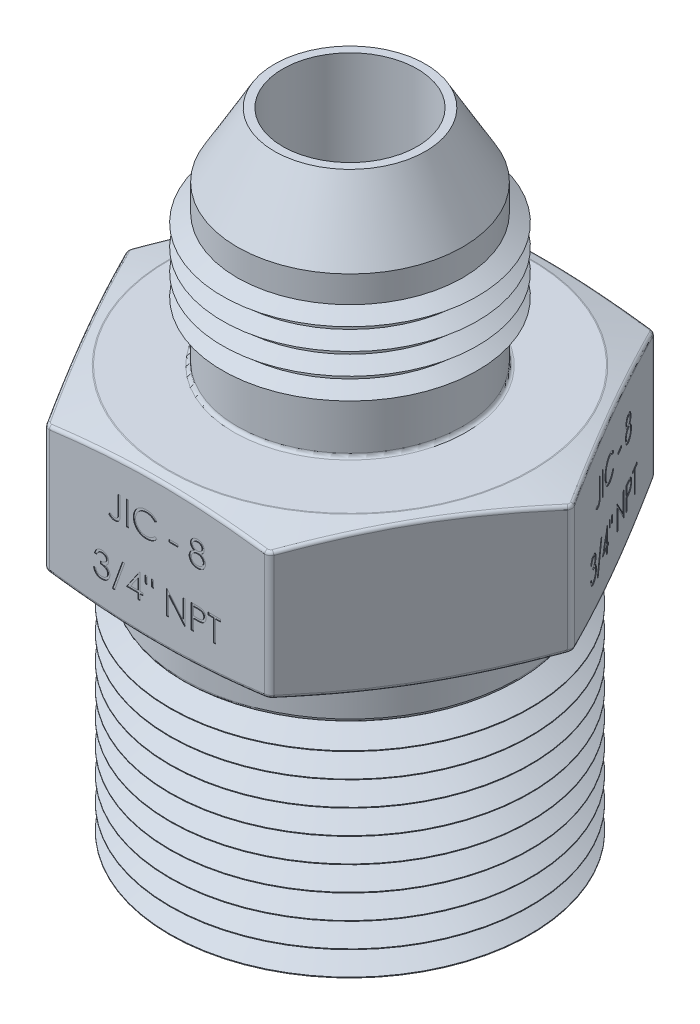
from build123d import *

# Parameters (mm, degrees)
BOSS_EXTRUDE1_DEPTH        = 5.461
SKETCH2_OUTSIDE_W          = 105.612
SKETCH2_OUTSIDE_H          = 101.192
SKETCH2_OUTSIDE_R          = 13.462
CUT_EXTRUDE1_DEPTH         = 8.255
CUT_EXTRUDE1_DRAFT         = -75
SKETCH3_OUTSIDE_W          = 105.612
SKETCH3_OUTSIDE_H          = 101.192
SKETCH3_OUTSIDE_R          = 13.462
CUT_EXTRUDE2_DEPTH         = 8.255
CUT_EXTRUDE2_DRAFT         = -75
FILLET1_R                  = 0.508
FILLET2_R                  = 0.254
SKETCH8_R                  = 8.3439
BOSS_EXTRUDE6_DEPTH        = 16.51
FILLET3_R                  = 0.254
SKETCH_PART_SPECS_INFO_W   = 0.159564103
SKETCH_PART_SPECS_INFO_H   = 1.778
SKETCH_PART_SPECS_INFO_W_2 = 0.683846154
SKETCH_PART_SPECS_INFO_H_2 = 0.182358975
CUT_PART_SPECS_DEPTH       = 0.0508
CHAMFER1_SIZE              = 4.7625
CHAMFER1_SIZE2             = 2.749630657
LPATTERN2_COUNT            = 4
LPATTERN2_PITCH            = 1.5875
SKETCH4_R                  = 12.3825
BOSS_EXTRUDE7_DEPTH        = 3.175
SKETCH13_R                 = 13.335
BOSS_EXTRUDE8_DEPTH        = 16.637
LPATTERN3_COUNT            = 10
LPATTERN3_PITCH            = 1.814285714
SKETCH15_R                 = 4.9784
CUT_EXTRUDE3_DEPTH         = 47.244
FILLET4_R                  = 0.254
CIRPATTERN1_COUNT          = 3
CHAMFER2_SIZE              = 0.508


with BuildPart() as part:
    # Sketch1 → Boss-Extrude1 (new, symmetric)
    with BuildSketch(Plane(origin=(0, 0, 0), x_dir=(1, 0, 0), z_dir=(0, 1, 0))):
        Polygon((16.497783942, 0), (8.248891971, 14.2875), (-8.248891971, 14.2875), (-16.497783942, 0), (-8.248891971, -14.2875), (8.248891971, -14.2875), align=None)
    extrude(amount=BOSS_EXTRUDE1_DEPTH, both=True)


with BuildPart() as cut_extrude1_tool:
    # Sketch2 outside → Cut-Extrude1 (with draft: the straight prism first)
    with BuildSketch(Plane(origin=(0, 5.461, 0), x_dir=(1, 0, 0), z_dir=(0, 1, 0))):
        Rectangle(SKETCH2_OUTSIDE_W, SKETCH2_OUTSIDE_H)
        Circle(SKETCH2_OUTSIDE_R, mode=Mode.SUBTRACT)
    extrude(amount=-CUT_EXTRUDE1_DEPTH)
    # Cut-Extrude1: the draft: its side faces are tilted about the plane it starts from
    cut_extrude1_sides = [cut_extrude1_tool.faces().sort_by_distance(p)[0] for p in [
        (0, 1.3335, 50.596),
        (52.806, 1.3335, 0),
        (0, 1.3335, -50.596),
        (-52.806, 1.3335, 0),
        (-13.462, 1.3335, 0),
    ]]
    draft(cut_extrude1_sides, Plane(origin=(0, 5.461, 0), x_dir=(1, 0, 0), z_dir=(0, 1, 0)), CUT_EXTRUDE1_DRAFT)


with BuildPart() as part_1:
    add(part.part)

    # Cut-Extrude1: cut by cut_extrude1_tool
    add(cut_extrude1_tool.part, mode=Mode.SUBTRACT)


with BuildPart() as cut_extrude2_tool:
    # Sketch3 outside → Cut-Extrude2 (with draft: the straight prism first)
    with BuildSketch(Plane.XZ.offset(5.461)):
        Rectangle(SKETCH3_OUTSIDE_W, SKETCH3_OUTSIDE_H)
        Circle(SKETCH3_OUTSIDE_R, mode=Mode.SUBTRACT)
    extrude(amount=-CUT_EXTRUDE2_DEPTH)
    # Cut-Extrude2: the draft: its side faces are tilted about the plane it starts from
    cut_extrude2_sides = [cut_extrude2_tool.faces().sort_by_distance(p)[0] for p in [
        (0, -1.3335, -50.596),
        (52.806, -1.3335, 0),
        (0, -1.3335, 50.596),
        (-52.806, -1.3335, 0),
        (-13.462, -1.3335, 0),
    ]]
    draft(cut_extrude2_sides, Plane.XZ.offset(5.461), CUT_EXTRUDE2_DRAFT)


with BuildPart() as part_2:
    add(part_1.part)

    # Cut-Extrude2: cut by cut_extrude2_tool
    add(cut_extrude2_tool.part, mode=Mode.SUBTRACT)

    # Fillet1
    # the kernel refuses this fillet: 0.508 mm, written as the material it takes off along each edge
    with BuildSketch(Plane(origin=(8.248891971, 5.380798986, 14.2875), x_dir=(0.5000000000000017, 0, -0.8660254037844377), z_dir=(0, -1, 0)), Plane(origin=(-8.248891971, 5.380798986, 14.2875), x_dir=(1, 0, 0), z_dir=(0, -1, 0)), Plane(origin=(-8.248891971, -5.380798986, -14.2875), x_dir=(1, 0, 0), z_dir=(0, 1, 0)), Plane(origin=(8.248891971, -5.380798986, -14.2875), x_dir=(0.4999999999999997, 0, 0.8660254037844387), z_dir=(0, 1, 0)), Plane(origin=(16.497783942, 5.380798986, 0), x_dir=(-0.5000000000000067, 0, -0.8660254037844349), z_dir=(0, -1, 0))) as fillet1_piece_1:
        with BuildLine():
            CenterArc((FILLET1_R * 0.57735026919, -FILLET1_R), FILLET1_R, 90, 60)
            Line((-FILLET1_R * 0.288675134595, -FILLET1_R * 0.5), (0, 0))
            Line((0, 0), (FILLET1_R * 0.57735026919, 0))
        make_face()
    extrude(amount=10.761597972, mode=Mode.SUBTRACT)
    with BuildSketch(Plane(origin=(-16.497783942, -5.380798986, 0), x_dir=(0.5000000000000077, 0, 0.8660254037844343), z_dir=(0, 1, 0))) as fillet1_piece_2:
        with BuildLine():
            CenterArc((FILLET1_R * 0.57735026919, FILLET1_R), FILLET1_R, 210, 60)
            Line((-FILLET1_R * 0.288675134595, FILLET1_R * 0.5), (0, 0))
            Line((0, 0), (FILLET1_R * 0.57735026919, 0))
        make_face()
    extrude(amount=10.761597972, mode=Mode.SUBTRACT)

    # Fillet2
    fillet2_edges = [part_2.edges().sort_by_distance(p)[0] for p in [
        (-13.462, 5.461, 0),
        (12.373337957, -5.239807942, 7.14375),
        (12.373337957, 5.239807942, 7.14375),
        (0, -5.239807942, 14.2875),
        (-12.373337957, -5.239807942, 7.14375),
        (-12.373337957, -5.239807942, -7.14375),
        (0, -5.239807942, -14.2875),
        (12.373337957, -5.239807942, -7.14375),
        (16.401812039, -4.673137939, 0.131757237),
        (8.209598034, -4.668621702, -14.219440905),
        (-8.209598034, -4.668621702, -14.219440905),
        (-16.419196069, -4.668621702, 0),
        (-8.209598034, -4.668621702, 14.219440905),
        (8.209598034, -4.668621702, 14.219440905),
        (0, 5.239807942, 14.2875),
        (12.373337957, 5.239807942, -7.14375),
        (0, 5.239807942, -14.2875),
        (-12.373337957, 5.239807942, -7.14375),
        (-12.373337957, 5.239807942, 7.14375),
        (16.401812039, 4.673137939, -0.131757237),
        (8.209598034, 4.668621702, -14.219440905),
        (-8.209598034, 4.668621702, -14.219440905),
        (-16.419196069, 4.668621702, 0),
        (-8.209598034, 4.668621702, 14.219440905),
        (8.209598034, 4.668621702, 14.219440905),
    ]]
    fillet(fillet2_edges, radius=FILLET2_R)

    # Sketch8 → Boss-Extrude6 (add)
    with BuildSketch(Plane(origin=(0, 5.461, 0), x_dir=(1, 0, 0), z_dir=(0, 1, 0))):
        with Locations(Location((0, 0, 0), (0, 0, 270))):
            Circle(SKETCH8_R)
    extrude(amount=BOSS_EXTRUDE6_DEPTH)

    # Fillet3
    fillet3_edges = [part_2.edges().sort_by_distance(p)[0] for p in [
        (0, 5.461, -8.3439),
    ]]
    fillet(fillet3_edges, radius=FILLET3_R)

    # Sketch Part Specs Info → Cut Part Specs (cut)
    # profile 1 of 13: a face of its own
    with BuildSketch(Plane.XY.offset(14.2875)):
        with BuildLine():
            Line((-2.883551282, 2.8981131), (-2.723987179, 2.8981131))
            Line((-2.723987179, 2.8981131), (-2.723987179, 1.697464462))
            add(Edge.make_bspline(
                [(-2.723987179, 1.697464462), (-2.72414665, 1.675262235), (-2.724452853, 1.63263125), (-2.726136574, 1.571227311), (-2.729252381, 1.515159003), (-2.733791367, 1.464298832), (-2.739846845, 1.418806133), (-2.746776488, 1.378329396), (-2.755164989, 1.343206437), (-2.767797154, 1.303767676), (-2.78851032, 1.260514623), (-2.819684775, 1.213801407), (-2.858411036, 1.172941234), (-2.903267961, 1.13745605), (-2.954647601, 1.109182177), (-3.011491896, 1.088884946), (-3.073450923, 1.076504551), (-3.116427323, 1.075197007), (-3.13856891, 1.074523356)],
                knots=[0, 0, 0, 0, 1.237770943, 2.376671248, 3.424123796, 4.367912054, 5.222547132, 5.982086412, 6.656319012, 7.234008312, 8.288027371, 9.317870876, 10.352700517, 11.413286737, 12.494591526, 13.606319346, 14.766767577, 16, 16, 16, 16], degree=3))
            add(Edge.make_bspline(
                [(-3.13856891, 1.074523356), (-3.155819756, 1.075072305), (-3.190529601, 1.076176828), (-3.242188481, 1.085179458), (-3.293700685, 1.099056008), (-3.345339621, 1.119377327), (-3.398125515, 1.147015371), (-3.452773283, 1.183177258), (-3.509985865, 1.227795673), (-3.547670974, 1.261850848), (-3.567397436, 1.279677202)],
                knots=[0, 0, 0, 0, 0.848567217, 1.707373443, 2.573483905, 3.470863513, 4.432650262, 5.500696352, 6.691726801, 8, 8, 8, 8], degree=3))
            Line((-3.567397436, 1.279677202), (-3.47336859, 1.416446433))
            add(Edge.make_bspline(
                [(-3.47336859, 1.416446433), (-3.451675629, 1.401487156), (-3.41071649, 1.37324209), (-3.350516234, 1.336906577), (-3.29717768, 1.305753393), (-3.262286743, 1.289877235), (-3.246132212, 1.282526561)],
                knots=[0, 0, 0, 0, 1.196737151, 2.259595785, 3.194191475, 4, 4, 4, 4], degree=3))
            add(Edge.make_bspline(
                [(-3.246132212, 1.282526561), (-3.236335781, 1.278686357), (-3.2171228, 1.271154861), (-3.18774766, 1.262749545), (-3.158540181, 1.258156), (-3.139176392, 1.257301883), (-3.129664663, 1.25688233)],
                knots=[0, 0, 0, 0, 1.051806502, 2.062826769, 3.048436908, 4, 4, 4, 4], degree=3))
            add(Edge.make_bspline(
                [(-3.129664663, 1.25688233), (-3.117379807, 1.25740188), (-3.093097175, 1.258428837), (-3.057809466, 1.267496269), (-3.024048786, 1.281336426), (-2.9930254, 1.301601203), (-2.964432424, 1.325696365), (-2.940839468, 1.354833217), (-2.921171108, 1.387124737), (-2.909334864, 1.417691836), (-2.90179372, 1.445569164), (-2.897007533, 1.471189197), (-2.892822294, 1.501141628), (-2.889174065, 1.53546221), (-2.887038194, 1.574219654), (-2.88464182, 1.617300159), (-2.883775547, 1.664812338), (-2.883628318, 1.697939502), (-2.883551282, 1.715272955)],
                knots=[0, 0, 0, 0, 0.997221856, 1.971139923, 2.944579524, 3.951425367, 4.971190333, 5.972282193, 6.985401279, 8.033996657, 8.624075553, 9.332086008, 10.151144245, 11.082816738, 12.137127781, 13.306538797, 14.590673636, 16, 16, 16, 16], degree=3))
            Line((-2.883551282, 1.715272955), (-2.883551282, 2.8981131))
        make_face()
    # profile 2 of 13: a face of its own
    with BuildSketch(Plane.XY.offset(14.2875)):
        with Locations((-2.188307693, 2.0091131)):
            Rectangle(SKETCH_PART_SPECS_INFO_W, SKETCH_PART_SPECS_INFO_H)
    # profile 3 of 13: a face of its own
    with BuildSketch(Plane.XY.offset(14.2875)):
        with BuildLine():
            Line((-0.011397436, 2.571861497), (-0.151016026, 2.465010536))
            add(Edge.make_bspline(
                [(-0.151016026, 2.465010536), (-0.160975817, 2.476880448), (-0.18076112, 2.500460241), (-0.212591995, 2.53357145), (-0.245765229, 2.564592603), (-0.280268143, 2.593671478), (-0.316721776, 2.619791195), (-0.354243061, 2.644312915), (-0.393459668, 2.666292926), (-0.44768955, 2.692944123), (-0.518630656, 2.720755169), (-0.607934435, 2.744074011), (-0.701158073, 2.758918368), (-0.764758453, 2.760526108), (-0.797108173, 2.761343869)],
                knots=[0, 0, 0, 0, 0.757959112, 1.505699292, 2.245454638, 2.979532153, 3.711538275, 4.438200793, 5.171680507, 5.909471876, 7.393775596, 8.890124382, 10.418191784, 12, 12, 12, 12], degree=3))
            add(Edge.make_bspline(
                [(-0.797108173, 2.761343869), (-0.814930489, 2.761138656), (-0.850409713, 2.760730135), (-0.903063138, 2.755340699), (-0.954733368, 2.747765804), (-1.005386793, 2.73652614), (-1.054958936, 2.72231605), (-1.103773876, 2.705335939), (-1.151124861, 2.684327681), (-1.197666926, 2.661107885), (-1.242258765, 2.634881143), (-1.284450729, 2.60627396), (-1.324088937, 2.575606459), (-1.361204744, 2.542763697), (-1.395836093, 2.507893581), (-1.427732047, 2.470624495), (-1.456782236, 2.431075591), (-1.483562485, 2.38976838), (-1.507546553, 2.346823182), (-1.527627732, 2.302081046), (-1.545410334, 2.256308162), (-1.559481549, 2.208987372), (-1.570619204, 2.160451647), (-1.578304057, 2.110570727), (-1.5836322, 2.059448818), (-1.58403869, 2.024798487), (-1.58424359, 2.00733225)],
                knots=[0, 0, 0, 0, 1.054917814, 2.100044995, 3.131103042, 4.146048494, 5.169673617, 6.183595914, 7.203665975, 8.234915748, 9.262203917, 10.264457458, 11.251630812, 12.227803204, 13.197192746, 14.159520551, 15.12972552, 16.100847026, 17.073214652, 18.039054194, 19.002613845, 19.979014051, 20.95965708, 21.949030935, 22.966165397, 24, 24, 24, 24], degree=3))
            add(Edge.make_bspline(
                [(-1.58424359, 2.00733225), (-1.583602586, 1.98105274), (-1.582344059, 1.929456407), (-1.571143506, 1.853880936), (-1.554122919, 1.781480434), (-1.528613406, 1.712707474), (-1.497158528, 1.646714028), (-1.457412298, 1.584616691), (-1.411379097, 1.525477076), (-1.358407692, 1.470692859), (-1.300289537, 1.420647886), (-1.237933598, 1.376578591), (-1.17149518, 1.33984263), (-1.101707852, 1.30927325), (-1.028034586, 1.285774832), (-0.950607866, 1.269232257), (-0.869596093, 1.25844123), (-0.814239637, 1.257408116), (-0.786066907, 1.25688233)],
                knots=[0, 0, 0, 0, 1.029171465, 2.020641659, 2.987623507, 3.938342917, 4.889210282, 5.84687017, 6.821220943, 7.821438502, 8.827599549, 9.822697543, 10.807740252, 11.797342354, 12.80366471, 13.83203677, 14.896651826, 16, 16, 16, 16], degree=3))
            add(Edge.make_bspline(
                [(-0.786066907, 1.25688233), (-0.755026741, 1.25774023), (-0.693932269, 1.259428783), (-0.604337312, 1.273733682), (-0.518568743, 1.296927904), (-0.436621949, 1.329388048), (-0.358727948, 1.371585215), (-0.284764845, 1.422739736), (-0.214670207, 1.48333821), (-0.172520796, 1.529608439), (-0.151016026, 1.553215664)],
                knots=[0, 0, 0, 0, 1.028121516, 2.023589091, 2.998037872, 3.967518031, 4.937445131, 5.927275754, 6.942489185, 8, 8, 8, 8], degree=3))
            Line((-0.151016026, 1.553215664), (-0.011397436, 1.447433212))
            add(Edge.make_bspline(
                [(-0.011397436, 1.447433212), (-0.022633436, 1.432935678), (-0.045051616, 1.404010053), (-0.081352288, 1.363232025), (-0.119593155, 1.324875975), (-0.160058256, 1.289251143), (-0.202282094, 1.255644675), (-0.247022829, 1.225011344), (-0.293692297, 1.196923575), (-0.342132373, 1.171205098), (-0.392291588, 1.148387136), (-0.444109841, 1.128852622), (-0.497363773, 1.112025178), (-0.552055819, 1.098181194), (-0.608299424, 1.087375484), (-0.665891625, 1.080151889), (-0.724956721, 1.075202996), (-0.764804963, 1.074751935), (-0.784998397, 1.074523356)],
                knots=[0, 0, 0, 0, 0.986787822, 1.968848986, 2.935600012, 3.899624008, 4.868462664, 5.837806735, 6.815139263, 7.798259679, 8.787526145, 9.778297419, 10.776456485, 11.791383307, 12.812564526, 13.85620153, 14.913611965, 16, 16, 16, 16], degree=3))
            add(Edge.make_bspline(
                [(-0.784998397, 1.074523356), (-0.80412138, 1.074656448), (-0.841934711, 1.074919622), (-0.897763277, 1.079182843), (-0.952113984, 1.084999309), (-1.004831494, 1.093757296), (-1.056203489, 1.10409222), (-1.105764266, 1.117946019), (-1.154001513, 1.133464995), (-1.20072143, 1.151704729), (-1.245963757, 1.172286949), (-1.289582574, 1.195549061), (-1.331557817, 1.221295449), (-1.372302171, 1.248958594), (-1.411213743, 1.279427063), (-1.448629734, 1.312277713), (-1.484759952, 1.347399823), (-1.507113316, 1.372726088), (-1.518352163, 1.385459654)],
                knots=[0, 0, 0, 0, 1.114604814, 2.203992996, 3.262667896, 4.300477797, 5.318619304, 6.316056647, 7.298880507, 8.271930387, 9.238335007, 10.195173496, 11.151986948, 12.108099108, 13.064862484, 14.031167946, 15.010108607, 16, 16, 16, 16], degree=3))
            add(Edge.make_bspline(
                [(-1.518352163, 1.385459654), (-1.53635347, 1.407578578), (-1.572138757, 1.451549387), (-1.617922604, 1.522814665), (-1.657113562, 1.597220516), (-1.68880053, 1.675157839), (-1.713571998, 1.756451752), (-1.730732845, 1.841143233), (-1.74188426, 1.929153188), (-1.743159487, 1.989014277), (-1.743807692, 2.019442026)],
                knots=[0, 0, 0, 0, 0.994628077, 1.977248131, 2.950237994, 3.925870899, 4.908910175, 5.911660606, 6.938484602, 8, 8, 8, 8], degree=3))
            add(Edge.make_bspline(
                [(-1.743807692, 2.019442026), (-1.743017654, 2.051423396), (-1.741463303, 2.114344746), (-1.728257439, 2.206685914), (-1.70701349, 2.295154825), (-1.676839871, 2.379586327), (-1.638584752, 2.460424509), (-1.591327233, 2.537051842), (-1.535616324, 2.609958376), (-1.47188896, 2.678037869), (-1.402004754, 2.740287861), (-1.327166796, 2.795053412), (-1.247521567, 2.84062991), (-1.163946498, 2.878727961), (-1.075815772, 2.908011348), (-0.983317421, 2.928510767), (-0.886625252, 2.941270262), (-0.82065514, 2.942883267), (-0.787135417, 2.943702843)],
                knots=[0, 0, 0, 0, 1.032925535, 2.032216505, 3.007276963, 3.968222605, 4.92396291, 5.891752235, 6.871517503, 7.883894988, 8.900124299, 9.891468569, 10.874487609, 11.85992873, 12.854644235, 13.869047385, 14.917252991, 16, 16, 16, 16], degree=3))
            add(Edge.make_bspline(
                [(-0.787135417, 2.943702843), (-0.766706465, 2.943457917), (-0.726269412, 2.94297311), (-0.666451065, 2.93824559), (-0.608212763, 2.930364678), (-0.551514384, 2.919637715), (-0.496080095, 2.906324395), (-0.442333573, 2.888981124), (-0.38995944, 2.869150566), (-0.33928801, 2.846311665), (-0.290562403, 2.820674561), (-0.243797793, 2.792523424), (-0.199365645, 2.761893155), (-0.15695331, 2.729044261), (-0.117270274, 2.693281793), (-0.079189843, 2.655589415), (-0.044005216, 2.614881432), (-0.022286593, 2.586227725), (-0.011397436, 2.571861497)],
                knots=[0, 0, 0, 0, 1.096760587, 2.17092713, 3.219439832, 4.250915756, 5.268269357, 6.278326846, 7.281116186, 8.274029601, 9.260640565, 10.235837813, 11.203064059, 12.156899882, 13.114053108, 14.069676657, 15.032185724, 16, 16, 16, 16], degree=3))
        make_face()
    # profile 4 of 13: a face of its own
    with BuildSketch(Plane.XY.offset(14.2875)):
        with Locations((1.219525641, 1.803959253)):
            Rectangle(SKETCH_PART_SPECS_INFO_W_2, SKETCH_PART_SPECS_INFO_H_2)
    # profile 5 of 13: a face of its own
    with BuildSketch(Plane.XY.offset(14.2875)):
        with BuildLine():
            add(Edge.make_bspline(
                [(3.246488381, 2.110621513), (3.261041843, 2.103033031), (3.289425955, 2.088232958), (3.329851176, 2.064402258), (3.366795477, 2.039286247), (3.401283882, 2.014071231), (3.432710465, 1.987791552), (3.460723826, 1.960342709), (3.486015937, 1.932409848), (3.508076743, 1.903519969), (3.527480737, 1.873749824), (3.544250901, 1.843021273), (3.55858524, 1.811401659), (3.569945613, 1.77854583), (3.579303883, 1.744936417), (3.585743091, 1.710139442), (3.589206085, 1.674384197), (3.589860802, 1.6502195), (3.590192308, 1.637984093)],
                knots=[0, 0, 0, 0, 1.272397273, 2.481599622, 3.635517121, 4.734568067, 5.792894095, 6.808321871, 7.773003508, 8.711915296, 9.623354172, 10.525449501, 11.423591555, 12.311487226, 13.218079475, 14.126165749, 15.051214107, 16, 16, 16, 16], degree=3))
            add(Edge.make_bspline(
                [(3.590192308, 1.637984093), (3.589800426, 1.620865645), (3.589024745, 1.586981813), (3.582268353, 1.536971188), (3.57215256, 1.488400403), (3.557380168, 1.441280106), (3.538221766, 1.395870304), (3.514611533, 1.352132127), (3.487885041, 1.309348718), (3.466420903, 1.283024462), (3.455560096, 1.269704446)],
                knots=[0, 0, 0, 0, 1.025265484, 2.029385089, 3.018602448, 3.995076438, 4.983346944, 5.966715145, 6.97116228, 8, 8, 8, 8], degree=3))
            add(Edge.make_bspline(
                [(3.455560096, 1.269704446), (3.441419167, 1.254162808), (3.413312053, 1.223271586), (3.365162325, 1.183164575), (3.312319208, 1.149459083), (3.254987176, 1.12199056), (3.19331948, 1.100610944), (3.127329262, 1.085247745), (3.056887872, 1.076447951), (3.008472693, 1.075175924), (2.983635016, 1.074523356)],
                knots=[0, 0, 0, 0, 0.954267603, 1.896743057, 2.838368354, 3.796610408, 4.779680527, 5.799409237, 6.871065594, 8, 8, 8, 8], degree=3))
            add(Edge.make_bspline(
                [(2.983635016, 1.074523356), (2.959752215, 1.075108815), (2.913278709, 1.076248058), (2.845634507, 1.083966829), (2.782579988, 1.097493786), (2.723748524, 1.116007647), (2.669494787, 1.140092043), (2.619973372, 1.170068315), (2.574469794, 1.204729887), (2.534364986, 1.245072239), (2.498760056, 1.288281638), (2.467483485, 1.332859456), (2.441487053, 1.378809762), (2.419476889, 1.425447396), (2.402627533, 1.473426043), (2.39095765, 1.522498849), (2.383546279, 1.572580102), (2.382560182, 1.606378182), (2.382064103, 1.623381128)],
                knots=[0, 0, 0, 0, 1.256902934, 2.445805442, 3.576955095, 4.645999104, 5.686449165, 6.692658513, 7.68621702, 8.689161843, 9.678783111, 10.630372946, 11.551080876, 12.453998257, 13.34127905, 14.221779781, 15.105423033, 16, 16, 16, 16], degree=3))
            add(Edge.make_bspline(
                [(2.382064103, 1.623381128), (2.382357666, 1.635857198), (2.382937851, 1.660514315), (2.386953514, 1.696942654), (2.393409413, 1.73239909), (2.402177217, 1.767014588), (2.414059858, 1.800537138), (2.428406862, 1.833125579), (2.445136294, 1.864816701), (2.464481525, 1.895783813), (2.486986954, 1.925593005), (2.512470088, 1.95475017), (2.541440245, 1.982802879), (2.573575136, 2.010093871), (2.608507522, 2.037107265), (2.647144747, 2.062383176), (2.688462555, 2.087711022), (2.717827701, 2.102853651), (2.732891426, 2.110621513)],
                knots=[0, 0, 0, 0, 0.941657376, 1.861047343, 2.762797495, 3.66048619, 4.553285746, 5.444104102, 6.34607688, 7.256116206, 8.197091036, 9.162375105, 10.176350973, 11.237807142, 12.343728897, 13.50695164, 14.721116704, 16, 16, 16, 16], degree=3))
            add(Edge.make_bspline(
                [(2.732891426, 2.110621513), (2.712271008, 2.121865976), (2.672344106, 2.143638402), (2.61947683, 2.18364178), (2.574066394, 2.22696799), (2.537360997, 2.274531925), (2.508469905, 2.324847738), (2.488648454, 2.377600618), (2.47523904, 2.431812403), (2.473910708, 2.468848751), (2.47324359, 2.487449237)],
                knots=[0, 0, 0, 0, 1.166880483, 2.259407225, 3.286803203, 4.280235371, 5.237608625, 6.161067461, 7.076446754, 8, 8, 8, 8], degree=3))
            add(Edge.make_bspline(
                [(2.47324359, 2.487449237), (2.474074385, 2.506396397), (2.475744429, 2.544483492), (2.489248756, 2.601179403), (2.51125535, 2.656864618), (2.541187216, 2.71126924), (2.578467922, 2.762551949), (2.623195567, 2.80854675), (2.674302042, 2.848836983), (2.731532238, 2.882657679), (2.793120246, 2.910182977), (2.858101434, 2.929171216), (2.925343612, 2.941584763), (2.971113254, 2.942990224), (2.994320112, 2.943702843)],
                knots=[0, 0, 0, 0, 0.888701115, 1.786444228, 2.72001202, 3.692817113, 4.693886446, 5.687152267, 6.695133018, 7.739871481, 8.800368666, 9.853104506, 10.91144658, 12, 12, 12, 12], degree=3))
            add(Edge.make_bspline(
                [(2.994320112, 2.943702843), (3.01692805, 2.942968101), (3.061508328, 2.941519273), (3.127037599, 2.929435539), (3.189737437, 2.909252943), (3.249391622, 2.881873153), (3.304932211, 2.848148587), (3.354006184, 2.807304943), (3.397355136, 2.761513036), (3.433212008, 2.710245877), (3.462758756, 2.656050307), (3.483333214, 2.599346066), (3.496516816, 2.541358344), (3.498179685, 2.502121438), (3.499012821, 2.482462859)],
                knots=[0, 0, 0, 0, 1.072916533, 2.115669174, 3.151510826, 4.193348718, 5.225979165, 6.227137561, 7.216255879, 8.211077061, 9.189680878, 10.138522389, 11.067357538, 12, 12, 12, 12], degree=3))
            add(Edge.make_bspline(
                [(3.499012821, 2.482462859), (3.498284064, 2.463170714), (3.496852827, 2.425282037), (3.484813257, 2.370048965), (3.464537294, 2.318323369), (3.436854259, 2.269518309), (3.400773312, 2.224518909), (3.356776075, 2.182752942), (3.305213324, 2.143877313), (3.266472794, 2.12193864), (3.246488381, 2.110621513)],
                knots=[0, 0, 0, 0, 0.975232327, 1.915300861, 2.843280834, 3.77672583, 4.742871857, 5.749627742, 6.839139064, 8, 8, 8, 8], degree=3))
        make_face()
        with BuildLine():
            add(Edge.make_bspline(
                [(2.985415865, 2.761343869), (2.972944056, 2.761012937), (2.948543744, 2.76036549), (2.912765979, 2.756982902), (2.878744016, 2.750402668), (2.846122389, 2.741645403), (2.815348353, 2.729815105), (2.786003959, 2.71589844), (2.758588627, 2.698978959), (2.732771405, 2.67999947), (2.709530011, 2.659124274), (2.688902899, 2.637374905), (2.671769017, 2.614324205), (2.657219333, 2.590545559), (2.646662322, 2.565333226), (2.638755656, 2.539460188), (2.633410789, 2.512599493), (2.633010287, 2.494242146), (2.632807692, 2.484956048)],
                knots=[0, 0, 0, 0, 1.203892937, 2.355340988, 3.463153438, 4.544400666, 5.610487187, 6.640501085, 7.674077295, 8.714426146, 9.728707835, 10.68524104, 11.601827946, 12.495867327, 13.368432065, 14.231010473, 15.105153427, 16, 16, 16, 16], degree=3))
            add(Edge.make_bspline(
                [(2.632807692, 2.484956048), (2.633156875, 2.475669549), (2.633846909, 2.457318094), (2.639183514, 2.430218394), (2.647137197, 2.403588202), (2.659659733, 2.37806074), (2.674679443, 2.352750473), (2.693217112, 2.328289975), (2.715309539, 2.30459412), (2.740215478, 2.281864452), (2.767348539, 2.26057988), (2.796093233, 2.242102304), (2.8260888, 2.226641776), (2.857027051, 2.213774438), (2.889223303, 2.20377195), (2.922480271, 2.196675878), (2.956803546, 2.192265423), (2.980060081, 2.191738616), (2.991826923, 2.191472074)],
                knots=[0, 0, 0, 0, 0.873023192, 1.725219244, 2.590779336, 3.480155217, 4.391973325, 5.357036234, 6.360879153, 7.436073238, 8.526419356, 9.601555421, 10.645666583, 11.697338044, 12.750135903, 13.812665442, 14.89329948, 16, 16, 16, 16], degree=3))
            add(Edge.make_bspline(
                [(2.991826923, 2.191472074), (3.006939976, 2.19191549), (3.037016811, 2.192797944), (3.081354711, 2.20100274), (3.124464934, 2.213908946), (3.165886698, 2.231567009), (3.204547827, 2.253729962), (3.239010582, 2.280264335), (3.268981003, 2.310557441), (3.294147633, 2.344137681), (3.313659835, 2.379876288), (3.328849954, 2.415741237), (3.337720251, 2.45211517), (3.338877255, 2.476482388), (3.339448718, 2.488517747)],
                knots=[0, 0, 0, 0, 1.076279235, 2.141928126, 3.20205304, 4.278698113, 5.344010996, 6.36967002, 7.368914609, 8.37248503, 9.349703398, 10.264243087, 11.142681841, 12, 12, 12, 12], degree=3))
            add(Edge.make_bspline(
                [(3.339448718, 2.488517747), (3.339178514, 2.496964789), (3.338642198, 2.513730957), (3.334222569, 2.538490047), (3.326919646, 2.562685875), (3.317032402, 2.586518325), (3.304022626, 2.609653017), (3.288597619, 2.632453626), (3.269860292, 2.654407234), (3.248830904, 2.676025452), (3.224982636, 2.696032536), (3.198361449, 2.713626969), (3.169103823, 2.728568446), (3.137209069, 2.740703934), (3.102794647, 2.749818647), (3.066019067, 2.756644312), (3.026575688, 2.760491452), (2.999433375, 2.761053567), (2.985415865, 2.761343869)],
                knots=[0, 0, 0, 0, 0.814439003, 1.616544685, 2.417341072, 3.248991801, 4.09997495, 4.973547432, 5.9003056, 6.880240646, 7.880314356, 8.896779544, 9.951930927, 11.043077905, 12.18215768, 13.381699519, 14.647792085, 16, 16, 16, 16], degree=3))
        make_face(mode=Mode.SUBTRACT)
        with BuildLine():
            add(Edge.make_bspline(
                [(2.995744792, 2.0091131), (2.979932893, 2.00883185), (2.948913805, 2.008280106), (2.903469685, 2.00213864), (2.859856277, 1.993589308), (2.818220629, 1.980619642), (2.778580324, 1.963755825), (2.74072077, 1.943469079), (2.704931596, 1.919488714), (2.671707011, 1.892119393), (2.641367559, 1.862625191), (2.614749223, 1.831402426), (2.592144483, 1.799031379), (2.573941191, 1.765100927), (2.559000031, 1.730329541), (2.549188582, 1.693851282), (2.542898672, 1.656367429), (2.542054055, 1.630886099), (2.541628205, 1.61803858)],
                knots=[0, 0, 0, 0, 1.140299081, 2.23698856, 3.303958914, 4.344563908, 5.37730929, 6.408454204, 7.439741482, 8.480804886, 9.510774543, 10.48932336, 11.43758569, 12.353841022, 13.263987381, 14.161954604, 15.073269652, 16, 16, 16, 16], degree=3))
            add(Edge.make_bspline(
                [(2.541628205, 1.61803858), (2.542320741, 1.60207168), (2.543694715, 1.570393723), (2.554594687, 1.523574883), (2.572087939, 1.478250587), (2.596484749, 1.434790195), (2.626694276, 1.394175541), (2.663842522, 1.358773643), (2.705620867, 1.327317532), (2.753442897, 1.301876621), (2.805679758, 1.281559234), (2.862317556, 1.267560805), (2.922543455, 1.258294149), (2.964128128, 1.257360353), (2.985415865, 1.25688233)],
                knots=[0, 0, 0, 0, 0.898778495, 1.783155532, 2.693654817, 3.627872908, 4.583023416, 5.533784346, 6.509005473, 7.520592997, 8.575161974, 9.658835044, 10.801527049, 12, 12, 12, 12], degree=3))
            add(Edge.make_bspline(
                [(2.985415865, 1.25688233), (3.002053052, 1.257201765), (3.034467628, 1.257824126), (3.08175529, 1.263317788), (3.12638032, 1.272029797), (3.168256182, 1.284701118), (3.207851652, 1.300169706), (3.244495396, 1.320069124), (3.279130088, 1.342701704), (3.310049062, 1.369553647), (3.338209132, 1.398245231), (3.362762445, 1.428618573), (3.384076881, 1.459848194), (3.400805807, 1.49263984), (3.414179544, 1.526364393), (3.423792709, 1.561332832), (3.429724227, 1.597652411), (3.430324122, 1.622289939), (3.430628205, 1.634778564)],
                knots=[0, 0, 0, 0, 1.224942928, 2.386581632, 3.501229538, 4.569074225, 5.605009692, 6.626002462, 7.634866581, 8.645888296, 9.63523824, 10.59253846, 11.518950513, 12.414518923, 13.29783783, 14.186679152, 15.080837789, 16, 16, 16, 16], degree=3))
            add(Edge.make_bspline(
                [(3.430628205, 1.634778564), (3.430168034, 1.646908253), (3.429260657, 1.670825881), (3.423501618, 1.706267277), (3.413384352, 1.740507906), (3.399502035, 1.773959709), (3.381020506, 1.805944888), (3.359255312, 1.837296703), (3.332994699, 1.867144977), (3.303321101, 1.89572155), (3.270982349, 1.922145544), (3.236607439, 1.945520879), (3.200460972, 1.965206954), (3.162619437, 1.981217334), (3.123166859, 1.993809368), (3.082132255, 2.002605894), (3.039467583, 2.008142892), (3.010483709, 2.008786043), (2.995744792, 2.0091131)],
                knots=[0, 0, 0, 0, 0.917430815, 1.809013306, 2.70690318, 3.612392954, 4.541220862, 5.495268465, 6.494511384, 7.542276156, 8.608045339, 9.649016899, 10.681629292, 11.715607085, 12.752076957, 13.808767841, 14.885711793, 16, 16, 16, 16], degree=3))
        make_face(mode=Mode.SUBTRACT)
    # profile 6 of 13: a face of its own
    with BuildSketch(Plane.XY.offset(14.2875)):
        with BuildLine():
            Line((-4.467794872, -1.740878582), (-4.627358974, -1.740878582))
            add(Edge.make_bspline(
                [(-4.627358974, -1.740878582), (-4.623036123, -1.72298048), (-4.614585301, -1.687991155), (-4.596958934, -1.638000267), (-4.577756912, -1.590693518), (-4.554699247, -1.546956712), (-4.5295488, -1.50591087), (-4.500733657, -1.468486955), (-4.469583238, -1.433733168), (-4.435128164, -1.402890843), (-4.398994804, -1.374962157), (-4.360674017, -1.351149628), (-4.320936787, -1.330664958), (-4.279507795, -1.31378908), (-4.2362637, -1.301076114), (-4.191595452, -1.291852457), (-4.145385994, -1.285862571), (-4.114018218, -1.285277984), (-4.098090545, -1.284981146)],
                knots=[0, 0, 0, 0, 1.162005537, 2.271625781, 3.343758855, 4.383309926, 5.390229558, 6.379919256, 7.361854164, 8.333198761, 9.295911338, 10.242430842, 11.177959212, 12.116337295, 13.062827104, 14.020064771, 14.994644689, 16, 16, 16, 16], degree=3))
            add(Edge.make_bspline(
                [(-4.098090545, -1.284981146), (-4.074883712, -1.285681795), (-4.028976254, -1.28706781), (-3.961532626, -1.299724344), (-3.896495002, -1.319752311), (-3.834575264, -1.347424964), (-3.777060301, -1.38155612), (-3.725886318, -1.422178206), (-3.681746954, -1.468507451), (-3.644716611, -1.519679594), (-3.615722511, -1.574368592), (-3.594342633, -1.630655072), (-3.581326819, -1.688405514), (-3.579639976, -1.727398212), (-3.578794872, -1.74693347)],
                knots=[0, 0, 0, 0, 1.083050992, 2.142477498, 3.193116406, 4.255571735, 5.30263384, 6.308962982, 7.297363603, 8.282367274, 9.249857812, 10.179914175, 11.08814088, 12, 12, 12, 12], degree=3))
            add(Edge.make_bspline(
                [(-3.578794872, -1.74693347), (-3.579385976, -1.765732922), (-3.580542675, -1.802520531), (-3.590364198, -1.856227052), (-3.606892619, -1.906844985), (-3.629788059, -1.954587415), (-3.659425566, -1.999151634), (-3.695327296, -2.040637907), (-3.737746648, -2.079230239), (-3.769892349, -2.101338131), (-3.786441907, -2.112719928)],
                knots=[0, 0, 0, 0, 1.024540389, 2.004866551, 2.965041327, 3.920577974, 4.882998113, 5.874504559, 6.905732034, 8, 8, 8, 8], degree=3))
            add(Edge.make_bspline(
                [(-3.786441907, -2.112719928), (-3.767528176, -2.12185284), (-3.730054604, -2.139947778), (-3.678974935, -2.175434503), (-3.632605774, -2.216407927), (-3.606746685, -2.248382795), (-3.593754006, -2.264448294)],
                knots=[0, 0, 0, 0, 1.015518401, 2.012035669, 3.001164323, 4, 4, 4, 4], degree=3))
            add(Edge.make_bspline(
                [(-3.593754006, -2.264448294), (-3.585198604, -2.276161632), (-3.568227901, -2.299396493), (-3.54728025, -2.336752998), (-3.52827642, -2.374523554), (-3.513468109, -2.413720532), (-3.502000584, -2.453889623), (-3.49380348, -2.495099801), (-3.488711216, -2.537384716), (-3.487981956, -2.565991456), (-3.487615385, -2.58037097)],
                knots=[0, 0, 0, 0, 1.025084078, 2.033381695, 3.024893161, 4.013698104, 4.991890475, 5.976764909, 6.982997093, 8, 8, 8, 8], degree=3))
            add(Edge.make_bspline(
                [(-3.487615385, -2.58037097), (-3.488526997, -2.605267908), (-3.490345933, -2.65494462), (-3.506604003, -2.728337778), (-3.531807529, -2.800080334), (-3.567599653, -2.868698352), (-3.611220347, -2.932899585), (-3.663116268, -2.99034235), (-3.722697763, -3.039719241), (-3.789147033, -3.080974037), (-3.861139334, -3.113952342), (-3.938139735, -3.136841523), (-4.019038762, -3.151749291), (-4.074516069, -3.1533479), (-4.102720753, -3.154160634)],
                knots=[0, 0, 0, 0, 0.955779014, 1.907060117, 2.875433937, 3.871313158, 4.872415639, 5.851225146, 6.836215519, 7.83643374, 8.849228613, 9.86973379, 10.916971861, 12, 12, 12, 12], degree=3))
            add(Edge.make_bspline(
                [(-4.102720753, -3.154160634), (-4.121729758, -3.153719581), (-4.15913314, -3.152851737), (-4.214120837, -3.146919008), (-4.26660826, -3.136083365), (-4.316666376, -3.121502086), (-4.364339655, -3.103015081), (-4.40948262, -3.079993183), (-4.452373006, -3.05291094), (-4.492606073, -3.021448677), (-4.530177025, -2.986253756), (-4.564087409, -2.946701379), (-4.594902584, -2.903522698), (-4.621797445, -2.856216185), (-4.645997017, -2.805393195), (-4.665900943, -2.750402958), (-4.683419611, -2.691737074), (-4.691564611, -2.650854382), (-4.69574359, -2.629878582)],
                knots=[0, 0, 0, 0, 1.048658725, 2.063410685, 3.046034179, 4.001477787, 4.936774919, 5.862367409, 6.792675028, 7.730719943, 8.675894397, 9.627829632, 10.600096036, 11.597688215, 12.626045268, 13.701542398, 14.82072376, 16, 16, 16, 16], degree=3))
            Line((-4.69574359, -2.629878582), (-4.536179487, -2.629878582))
            add(Edge.make_bspline(
                [(-4.536179487, -2.629878582), (-4.532022375, -2.643568681), (-4.523936431, -2.670197112), (-4.510172528, -2.708520787), (-4.494491445, -2.743653079), (-4.47766925, -2.775851704), (-4.460001799, -2.805433765), (-4.440233017, -2.831617034), (-4.419827091, -2.855551557), (-4.40444518, -2.86903622), (-4.396917067, -2.875635794)],
                knots=[0, 0, 0, 0, 1.198163088, 2.33053128, 3.407730985, 4.417276592, 5.372219308, 6.28897303, 7.162600585, 8, 8, 8, 8], degree=3))
            add(Edge.make_bspline(
                [(-4.396917067, -2.875635794), (-4.386962006, -2.883310827), (-4.367082614, -2.898637204), (-4.334688352, -2.918196031), (-4.30061939, -2.935143432), (-4.264137536, -2.948089149), (-4.226030032, -2.959050601), (-4.185680931, -2.966223825), (-4.143446208, -2.971145416), (-4.114608185, -2.971579721), (-4.099871394, -2.971801659)],
                knots=[0, 0, 0, 0, 0.946170439, 1.889420265, 2.845303464, 3.807233317, 4.801018734, 5.828864929, 6.890507805, 8, 8, 8, 8], degree=3))
            add(Edge.make_bspline(
                [(-4.099871394, -2.971801659), (-4.083232615, -2.971488779), (-4.050696918, -2.97087697), (-4.00322185, -2.965250511), (-3.958056866, -2.957056261), (-3.91570342, -2.944400465), (-3.875606722, -2.928763793), (-3.838328844, -2.909130403), (-3.803380422, -2.886095284), (-3.771209084, -2.859913392), (-3.742280767, -2.831251272), (-3.716809894, -2.801272632), (-3.695156566, -2.770103871), (-3.677689708, -2.737572505), (-3.663897229, -2.703813249), (-3.654507763, -2.668731364), (-3.647979193, -2.632613952), (-3.647447514, -2.608062836), (-3.647179487, -2.595686275)],
                knots=[0, 0, 0, 0, 1.217147791, 2.380027433, 3.494444702, 4.572153297, 5.609568379, 6.639424714, 7.649109417, 8.668170816, 9.669597737, 10.625200337, 11.543417969, 12.441394052, 13.322311151, 14.205496177, 15.095365482, 16, 16, 16, 16], degree=3))
            add(Edge.make_bspline(
                [(-3.647179487, -2.595686275), (-3.64795688, -2.579119714), (-3.649507799, -2.546069027), (-3.661348557, -2.497444499), (-3.6808247, -2.450595006), (-3.708090336, -2.406319864), (-3.741280886, -2.365285706), (-3.780074258, -2.328673393), (-3.824792598, -2.298462587), (-3.865950692, -2.27758955), (-3.902407391, -2.263346715), (-3.933606407, -2.253859834), (-3.968534761, -2.245826496), (-4.006770066, -2.238352663), (-4.04860042, -2.231991818), (-4.093980283, -2.226687375), (-4.14291885, -2.222443014), (-4.176797962, -2.220547618), (-4.19425641, -2.21957089)],
                knots=[0, 0, 0, 0, 1.07054697, 2.135767047, 3.216561865, 4.33974944, 5.486079747, 6.621378074, 7.775625952, 8.963672916, 9.598146892, 10.304877434, 11.070270905, 11.915000392, 12.823868403, 13.805723172, 14.86925407, 16, 16, 16, 16], degree=3))
            Line((-4.19425641, -2.21957089), (-4.19425641, -2.037211916))
            add(Edge.make_bspline(
                [(-4.19425641, -2.037211916), (-4.172259418, -2.036838635), (-4.129172714, -2.036107471), (-4.066234407, -2.027264202), (-4.006049965, -2.015031243), (-3.94995318, -1.996293565), (-3.898823633, -1.974530694), (-3.854465275, -1.949205772), (-3.817499565, -1.921055079), (-3.78810614, -1.889644114), (-3.765993292, -1.855956069), (-3.749825279, -1.820844807), (-3.740274713, -1.784002584), (-3.738999803, -1.758859293), (-3.738358974, -1.74622113)],
                knots=[0, 0, 0, 0, 1.321986639, 2.589447074, 3.816329219, 5.01088745, 6.139805852, 7.153945165, 8.075214402, 8.924034688, 9.728124013, 10.488707548, 11.240355623, 12, 12, 12, 12], degree=3))
            add(Edge.make_bspline(
                [(-3.738358974, -1.74622113), (-3.738569495, -1.736936036), (-3.738988316, -1.718463781), (-3.744270133, -1.691476246), (-3.752207146, -1.665313765), (-3.763118849, -1.640087598), (-3.77772395, -1.615972698), (-3.795202191, -1.592763474), (-3.816013986, -1.570592435), (-3.839862273, -1.549926832), (-3.86547147, -1.53023206), (-3.893538355, -1.513511932), (-3.923216668, -1.499214241), (-3.954539264, -1.487423814), (-3.987607794, -1.478554495), (-4.022266885, -1.472186288), (-4.058582628, -1.468204759), (-4.083358668, -1.467631524), (-4.095953526, -1.467340121)],
                knots=[0, 0, 0, 0, 0.884392785, 1.759457502, 2.611959086, 3.489218968, 4.37281399, 5.2945488, 6.255912374, 7.266815255, 8.301784654, 9.332968512, 10.37626691, 11.440494194, 12.520033166, 13.637162961, 14.798855837, 16, 16, 16, 16], degree=3))
            add(Edge.make_bspline(
                [(-4.095953526, -1.467340121), (-4.116198173, -1.468046933), (-4.155740678, -1.469427501), (-4.212745856, -1.481519432), (-4.265740077, -1.500812298), (-4.30624732, -1.523841472), (-4.336159668, -1.546574692), (-4.357534752, -1.566428544), (-4.378525571, -1.588492419), (-4.397751175, -1.614125274), (-4.417194355, -1.641591203), (-4.434895393, -1.672286433), (-4.452096116, -1.705410265), (-4.462460612, -1.728826848), (-4.467794872, -1.740878582)],
                knots=[0, 0, 0, 0, 1.472543308, 2.876219568, 4.221790263, 5.565193594, 6.249813518, 6.953379497, 7.687249741, 8.463570142, 9.283606569, 10.136032583, 11.040678096, 12, 12, 12, 12], degree=3))
        make_face()
    # profile 7 of 13: a face of its own
    with BuildSketch(Plane.XY.offset(14.2875)):
        Polygon((-2.393461538, -1.284981146), (-3.137144231, -3.35931448), (-3.30525641, -3.35931448), (-2.561573718, -1.284981146), align=None)
    # profile 8 of 13: a face of its own
    with BuildSketch(Plane.XY.offset(14.2875)):
        Polygon((-1.286129407, -1.284981146), (-1.253717949, -1.284981146), (-1.253717949, -2.515904223), (-1.048564103, -2.515904223), (-1.048564103, -2.698263198), (-1.253717949, -2.698263198), (-1.253717949, -3.10857089), (-1.413282051, -3.10857089), (-1.413282051, -2.698263198), (-2.256692308, -2.698263198), align=None)
        Polygon((-1.413282051, -2.515904223), (-1.413282051, -1.743727941), (-1.943262821, -2.515904223), align=None, mode=Mode.SUBTRACT)
    # profile 9 of 13: a face of its own
    with BuildSketch(Plane.XY.offset(14.2875)):
        Polygon((-0.275675481, -1.832058069), (-0.386444311, -1.832058069), (-0.410307692, -1.284981146), (-0.25074359, -1.284981146), align=None)
    # profile 10 of 13: a face of its own
    with BuildSketch(Plane.XY.offset(14.2875)):
        Polygon((-0.753299279, -1.832058069), (-0.865136619, -1.832058069), (-0.889, -1.284981146), (-0.729435897, -1.284981146), align=None)
    # profile 11 of 13: a face of its own
    with BuildSketch(Plane.XY.offset(14.2875)):
        Polygon((0.706641026, -3.10857089), (0.706641026, -1.33057089), (0.740120994, -1.33057089), (1.914769231, -2.729962316), (1.914769231, -1.33057089), (2.074333333, -1.33057089), (2.074333333, -3.10857089), (2.038004006, -3.10857089), (0.866205128, -1.712384993), (0.866205128, -3.10857089), align=None)
    # profile 12 of 13: a face of its own
    with BuildSketch(Plane.XY.offset(14.2875)):
        with BuildLine():
            Line((2.530230769, -1.33057089), (2.878921074, -1.33057089))
            add(Edge.make_bspline(
                [(2.878921074, -1.33057089), (2.902904214, -1.330597253), (2.948856976, -1.330647767), (3.014752224, -1.332179257), (3.074599568, -1.334224817), (3.128269961, -1.337060419), (3.175928539, -1.340411487), (3.217359647, -1.345111523), (3.252888942, -1.350018953), (3.274177418, -1.355008227), (3.283886218, -1.35728363)],
                knots=[0, 0, 0, 0, 1.415646017, 2.712440637, 3.8905458, 4.950247383, 5.884950622, 6.709939814, 7.411656543, 8, 8, 8, 8], degree=3))
            add(Edge.make_bspline(
                [(3.283886218, -1.35728363), (3.296176533, -1.360647581), (3.320467558, -1.367296215), (3.355469287, -1.380612786), (3.388770641, -1.396402526), (3.420485873, -1.414397887), (3.450225251, -1.435370954), (3.47843248, -1.458471552), (3.50485863, -1.484233029), (3.529355097, -1.512366445), (3.551851774, -1.542399511), (3.571221653, -1.574780564), (3.587440684, -1.608964546), (3.601351386, -1.64492768), (3.611363281, -1.682971965), (3.618905506, -1.722833055), (3.623692709, -1.764506677), (3.62415121, -1.79298509), (3.624384615, -1.807482348)],
                knots=[0, 0, 0, 0, 0.999701418, 1.975846123, 2.934577507, 3.890451536, 4.834027766, 5.787354733, 6.749476667, 7.726910423, 8.712836071, 9.690891519, 10.682875813, 11.679750201, 12.712814741, 13.765529915, 14.8625177, 16, 16, 16, 16], degree=3))
            add(Edge.make_bspline(
                [(3.624384615, -1.807482348), (3.624170532, -1.822101459), (3.623751662, -1.850704736), (3.618724349, -1.892550113), (3.611952612, -1.932539055), (3.601540109, -1.970582896), (3.587902507, -2.006455707), (3.571904545, -2.040705693), (3.552608911, -2.072750166), (3.530437338, -2.102705462), (3.505773128, -2.130599697), (3.478720635, -2.156230733), (3.449389075, -2.179448537), (3.417871663, -2.200305159), (3.38386114, -2.218316949), (3.347873326, -2.23444966), (3.309595416, -2.247998559), (3.283107019, -2.25512583), (3.269639423, -2.258749576)],
                knots=[0, 0, 0, 0, 1.121902311, 2.195077645, 3.232258892, 4.234102512, 5.217864754, 6.176164875, 7.132989551, 8.084763148, 9.034132444, 9.988522005, 10.94243251, 11.903244335, 12.886203696, 13.894208494, 14.929344452, 16, 16, 16, 16], degree=3))
            add(Edge.make_bspline(
                [(3.269639423, -2.258749576), (3.258500337, -2.26111837), (3.234088384, -2.266309721), (3.193883881, -2.272105217), (3.147074025, -2.277051918), (3.093722706, -2.280760896), (3.033877815, -2.283936083), (2.967506976, -2.286459875), (2.894479905, -2.287846641), (2.843542113, -2.287918163), (2.816947516, -2.287955505)],
                knots=[0, 0, 0, 0, 0.601384939, 1.31797006, 2.144135048, 3.087295005, 4.142315834, 5.309527816, 6.595305764, 8, 8, 8, 8], degree=3))
            Line((2.816947516, -2.287955505), (2.689794872, -2.287955505))
            Line((2.689794872, -2.287955505), (2.689794872, -3.10857089))
            Line((2.689794872, -3.10857089), (2.530230769, -3.10857089))
            Line((2.530230769, -3.10857089), (2.530230769, -1.33057089))
        make_face()
        with BuildLine():
            Line((2.689794872, -1.512929864), (2.689794872, -2.105596531))
            Line((2.689794872, -2.105596531), (3.00108734, -2.1095144))
            add(Edge.make_bspline(
                [(3.00108734, -2.1095144), (3.016286662, -2.109522255), (3.04562864, -2.10953742), (3.088014242, -2.107512926), (3.12733816, -2.105175856), (3.163479604, -2.101754007), (3.196454867, -2.096917208), (3.226318931, -2.092034445), (3.252840231, -2.084970521), (3.283878626, -2.075459202), (3.318464966, -2.059237433), (3.356091281, -2.035691689), (3.387978739, -2.005678689), (3.415572433, -1.971933351), (3.437470219, -1.934392593), (3.453500664, -1.894225573), (3.462919571, -1.851844226), (3.464182558, -1.822843451), (3.464820513, -1.808194688)],
                knots=[0, 0, 0, 0, 1.160613943, 2.240541288, 3.23993089, 4.169200891, 5.011653406, 5.7853311, 6.478053781, 7.106038997, 8.262395093, 9.384106736, 10.481365981, 11.59014053, 12.70357646, 13.786202915, 14.881775077, 16, 16, 16, 16], degree=3))
            add(Edge.make_bspline(
                [(3.464820513, -1.808194688), (3.464179088, -1.793900323), (3.462904016, -1.765484895), (3.453426838, -1.723839685), (3.437501386, -1.684095947), (3.415425436, -1.64702562), (3.388632942, -1.613401707), (3.357492876, -1.584193167), (3.322078539, -1.560712542), (3.289135638, -1.545557234), (3.259874235, -1.536303875), (3.234458, -1.529829496), (3.205760737, -1.524660288), (3.173773105, -1.52047462), (3.138743033, -1.516891462), (3.100369569, -1.514460185), (3.058798079, -1.513037046), (3.029938309, -1.512966456), (3.014977965, -1.512929864)],
                knots=[0, 0, 0, 0, 1.120700087, 2.227813068, 3.331159281, 4.466773991, 5.599788987, 6.693661531, 7.80175334, 8.91857717, 9.525282508, 10.207424825, 10.974604443, 11.810962634, 12.737642355, 13.736264703, 14.826523623, 16, 16, 16, 16], degree=3))
            Line((3.014977965, -1.512929864), (2.689794872, -1.512929864))
        make_face(mode=Mode.SUBTRACT)
    # profile 13 of 13: a face of its own
    with BuildSketch(Plane.XY.offset(14.2875)):
        Polygon((3.783948718, -1.512929864), (3.783948718, -1.33057089), (4.718538462, -1.33057089), (4.718538462, -1.512929864), (4.331025641, -1.512929864), (4.331025641, -3.10857089), (4.171461538, -3.10857089), (4.171461538, -1.512929864), align=None)
    cut_part_specs = extrude(amount=-CUT_PART_SPECS_DEPTH, mode=Mode.SUBTRACT)

    # Chamfer1
    chamfer1_edges = [part_2.edges().sort_by_distance(p)[0] for p in [
        (0, 21.971, -8.3439),
    ]]
    chamfer1_side = [part_2.faces().sort_by_distance(p)[0] for p in [
        (0, 13.843, -8.3439),
    ]]
    chamfer(chamfer1_edges, length=CHAMFER1_SIZE, length2=CHAMFER1_SIZE2, reference=chamfer1_side[0])

    # Sketch12 → Revolve2 (revolve)
    with BuildSketch(Plane.XY, mode=Mode.PRIVATE) as revolve2_sk:
        Polygon((8.3439, 15.24), (8.3439, 13.97), (9.443752263, 14.605), align=None)
    revolve2 = revolve(revolve2_sk.sketch.rotate(Axis((0, 0, 0), (0, 1, 0)), 90), axis=Axis((0, 0, 0), (0, 1, 0)))

    # LPattern2: Revolve2 ×4
    with Locations(*[(0, -i * LPATTERN2_PITCH, 0) for i in range(1, LPATTERN2_COUNT)]):
        add(revolve2)

    # Sketch4 → Boss-Extrude7 (add)
    with BuildSketch(Plane.XZ.offset(5.461)):
        with Locations(Location((0, 0, 0), (0, 0, 90))):
            Circle(SKETCH4_R)
    extrude(amount=BOSS_EXTRUDE7_DEPTH)

    # Sketch13 → Boss-Extrude8 (add)
    with BuildSketch(Plane.XZ.offset(8.636)):
        with Locations(Location((0, 0, 0), (0, 0, 90))):
            Circle(SKETCH13_R)
    extrude(amount=BOSS_EXTRUDE8_DEPTH)

    # Sketch14 → Cut-Revolve1 (revolve, cut)
    with BuildSketch(Plane.XY, mode=Mode.PRIVATE) as cut_revolve1_sk:
        Polygon((15.196503233, -24.365857143), (15.196503233, -26.180142857), (13.382217518, -26.180142857), (11.811, -25.273), (13.382217518, -24.365857143), align=None)
    cut_revolve1 = revolve(cut_revolve1_sk.sketch.rotate(Axis((0, 0, 0), (0, -1, 0)), 270), axis=Axis((0, 0, 0), (0, -1, 0)), mode=Mode.SUBTRACT)

    # LPattern3: Cut-Revolve1 ×10
    with Locations(*[(0, i * LPATTERN3_PITCH, 0) for i in range(1, LPATTERN3_COUNT)]):
        add(cut_revolve1, mode=Mode.SUBTRACT)

    # Sketch15 → Cut-Extrude3 (cut)
    with BuildSketch(Plane.XZ.offset(25.273)):
        with Locations(Location((0, 0, 0), (0, 0, 270))):
            Circle(SKETCH15_R)
    extrude(amount=-CUT_EXTRUDE3_DEPTH, mode=Mode.SUBTRACT)

    # Fillet4
    fillet4_edges = [part_2.edges().sort_by_distance(p)[0] for p in [
        (-13.462, -5.461, 0),
        (0, -5.461, -12.3825),
        (12.3825, -8.614472893, 0),
    ]]
    fillet(fillet4_edges, radius=FILLET4_R)

    # CirPattern1: Cut Part Specs ×3 about axis
    cirpattern1_axis = Axis((0, 36.052041598, 0), (0, -1, 0))
    for i in range(1, CIRPATTERN1_COUNT):
        add(cut_part_specs.rotate(cirpattern1_axis, i * 360 / CIRPATTERN1_COUNT), mode=Mode.SUBTRACT)

    # Chamfer2
    chamfer2_edges = [part_2.edges().sort_by_distance(p)[0] for p in [
        (0, -25.273, 4.9784),
    ]]
    chamfer(chamfer2_edges, length=CHAMFER2_SIZE)


solid = part_2.part
